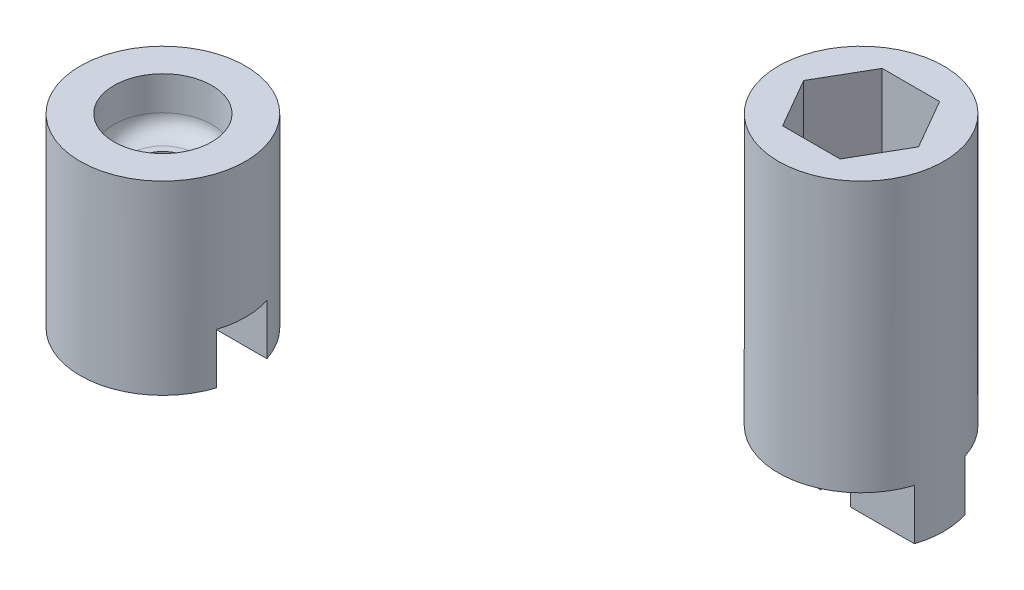
from build123d import *
from build123d.topology import SkipClean

# Parameters (mm, degrees)
EXTRUDE_1_DEPTH          = 3
SKETCH_2_R               = 5.35
EXTRUDE_2_DEPTH          = 23
CUT_EXTRUDE_1_DEPTH      = 3
SKETCH_4_R               = 5
EXTRUDE_3_DEPTH          = 100
EXTRUDE_START            = 3
SKETCH_5_R               = 5
EXTRUDE_4_DEPTH          = 3
SKETCH_6_R               = 5.35
EXTRUDE_5_DEPTH          = 5
SKETCH_7_R               = 5.35
EXTRUDE_6_DEPTH          = 5
SKETCH_8_W               = 75
SKETCH_8_H               = 10.7
EXTRUDE_7_DEPTH          = 3
EXTRUDE_8_DEPTH          = 3
CUT_EXTRUDE_2_DEPTH      = 3
SKETCH_12_R              = 6
EXTRUDE_10_DEPTH         = 13
SKETCH_13_R              = 3
CUT_EXTRUDE_3_DEPTH      = 23
SKETCH_14_R              = 3.125
CUT_EXTRUDE_5_DEPTH      = 100
SKETCH_15_R              = 6
SKETCH_15_R_2            = 5.35
EXTRUDE_11_DEPTH         = 5
SKETCH_16_R              = 6
SKETCH_16_R_2            = 3
EXTRUDE_12_DEPTH         = 5
SKETCH_17_R              = 5.35
SKETCH_17_R_2            = 3
EXTRUDE_13_DEPTH         = 5
SKETCH_18_R              = 5.35
SKETCH_18_R_2            = 3
EXTRUDE_14_DEPTH         = 5
SKETCH_20_R              = 6
SKETCH_20_R_2            = 5.35
EXTRUDE_15_DEPTH         = 5
SKETCH_21_R              = 6
SKETCH_21_R_2            = 5.35
EXTRUDE_16_DEPTH         = 5
SKETCH_22_R              = 5.35
SKETCH_22_R_2            = 3
EXTRUDE_17_DEPTH         = 5
SKETCH_23_R              = 5.35
SKETCH_23_R_2            = 3
EXTRUDE_18_DEPTH         = 5
SKETCH_25_R              = 7.5
EXTRUDE_20_DEPTH         = 3
EXTRUDE_21_DEPTH         = 3
EXTRUDE_23_DEPTH         = 3
SKETCH_30_R              = 7.5
EXTRUDE_24_DEPTH         = 3
FILLET_1_R               = 3
EXTRUDE_29_DEPTH         = 5
EXTRUDE_31_DEPTH         = 2
SKETCH_50_R              = 5.998205811
EXTRUDE_32_DEPTH         = 103
CUT_EXTRUDE_START        = -95
SKETCH_52_R              = 5.998205811
SKETCH_52_R_2            = 4.9
CUT_EXTRUDE_7_DEPTH      = 95
CUT_EXTRUDE_START_2      = -44
SKETCH_53_R              = 4.9
CUT_EXTRUDE_8_DEPTH      = 44
SKETCH_54_R              = 1.5
EXTRUDE_33_DEPTH         = 5
CUT_EXTRUDE_9_DEPTH      = 56
CUT_EXTRUDE_START_3      = -6
SKETCH_56_R              = 1.5
CUT_EXTRUDE_10_DEPTH     = 6
SKETCH_57_R              = 15
EXTRUDE_34_DEPTH         = 3
SKETCH_58_R              = 4.9
EXTRUDE_35_DEPTH         = 51
CUT_EXTRUDE_11_DEPTH     = 5
SKETCH_60_R              = 2.75
CUT_EXTRUDE_12_DEPTH     = 46
SKETCH_61_R              = 1.5
CUT_EXTRUDE_13_DEPTH     = 9
CUT_EXTRUDE_14_DEPTH     = 1.65
SKETCH_63_R              = 1
CUT_EXTRUDE_15_DEPTH     = 1.5
PATTERN_CIRCULAR_1_COUNT = 8
SKETCH_64_R              = 3.175426481
CUT_EXTRUDE_17_DEPTH     = 5
CUT_EXTRUDE_18_DEPTH     = 56
FILLET_2_R               = 1
EXTRUDE_36_DEPTH         = 5
SKETCH_67_R              = 1.5
CUT_EXTRUDE_19_DEPTH     = 5
FILLET_3_R               = 1
SKETCH_69_R              = 4.9
EXTRUDE_37_DEPTH         = 3
CUT_EXTRUDE_20_DEPTH     = 3
CUT_EXTRUDE_21_DEPTH     = 3
SKETCH_71_R              = 2.9
CUT_EXTRUDE_22_DEPTH     = 46
FILLET_4_R               = 1
SKETCH_72_R              = 1.742227019
CUT_EXTRUDE_23_DEPTH     = 3
SKETCH_73_R              = 80.568132645
CUT_EXTRUDE_24_DEPTH     = 40
SKETCH_74_R              = 81.791796687
CUT_EXTRUDE_25_DEPTH     = 40


with BuildPart() as part:
    # 草图1 → 凸台-拉伸1 (new body)
    with BuildSketch(Plane(origin=(0, 0, 0), x_dir=(1, 0, 0), z_dir=(0, 1, 0))):
        Polygon((-18.65535641, 0), (18.84464359, -42.930983399), (56.34464359, 0), align=None)
    extrude(amount=EXTRUDE_1_DEPTH)

    # 草图2 → 凸台-拉伸2 (add)
    with BuildSketch(Plane(origin=(0, 3, 0), x_dir=(1, 0, 0), z_dir=(0, 1, 0))):
        with Locations(Location((56.34464359, 0, 0), (0, 0, 270))):
            Circle(SKETCH_2_R)
        with Locations(Location((-18.65535641, 0, 0), (0, 0, 270))):
            Circle(SKETCH_2_R)
    extrude(amount=-EXTRUDE_2_DEPTH)

    # 草图3 → 切除-拉伸1 (cut)
    with BuildSketch(Plane.XZ):
        Polygon((8.632668758, 17.559374543), (1.15609776, 9), (33.75905687, 9), (36.53318942, 9), (29.056618422, 17.559374543), (18.84464359, 29.25031113), align=None)
    extrude(amount=-CUT_EXTRUDE_1_DEPTH, mode=Mode.SUBTRACT)

    # 草图4 → 凸台-拉伸3 (add)
    with BuildSketch(Plane.XZ):
        with Locations(Location((18.84464359, 42.930983399, 0), (0, 0, 228.862949093))):
            Circle(SKETCH_4_R)
    extrude(amount=EXTRUDE_3_DEPTH)

    # 草图5 → 凸台-拉伸4 (add)
    with BuildSketch(Plane(origin=(0, 0, 0), x_dir=(1, 0, 0), z_dir=(0, 1, 0)).offset(EXTRUDE_START)):
        with Locations(Location((18.84464359, -42.930983399, 0), (0, 0, 131.137050907))):
            Circle(SKETCH_5_R)
    extrude(amount=-EXTRUDE_4_DEPTH)

    # 草图6 → 凸台-拉伸5 (add)
    with SkipClean():  # the faces are left unmerged after this step: merging them gives an invalid solid
        with BuildSketch(Plane.XZ.offset(20)):
            with Locations(Location((56.34464359, 0, 0), (0, 0, 131.137050907))):
                Circle(SKETCH_6_R)
        extrude(amount=EXTRUDE_5_DEPTH)
    add(part.part.scale(1), mode=Mode.REPLACE)  # the faces are merged on a copy

    # 草图7 → 凸台-拉伸6 (add)
    with BuildSketch(Plane.XZ.offset(20)):
        with Locations(Location((-18.65535641, 0, 0), (0, 0, 48.862949093))):
            Circle(SKETCH_7_R)
    extrude(amount=EXTRUDE_6_DEPTH)

    # 草图8 → 凸台-拉伸7 (add)
    with SkipClean():  # the faces are left unmerged after this step: merging them gives an invalid solid
        with BuildSketch(Plane(origin=(0, 3, 0), x_dir=(1, 0, 0), z_dir=(0, 1, 0))):
            with Locations((18.84464359, 0)):
                Rectangle(SKETCH_8_W, SKETCH_8_H)
        extrude(amount=-EXTRUDE_7_DEPTH)

    # 草图9 → 凸台-拉伸8 (add)
    with SkipClean():  # the faces are left unmerged after this step: merging them gives an invalid solid
        with BuildSketch(Plane(origin=(0, 3, 0), x_dir=(1, 0, 0), z_dir=(0, 1, 0))):
            Polygon((61.69464359, 0), (18.84464359, -47.930983399), (-24.00535641, 0), align=None)
        extrude(amount=-EXTRUDE_8_DEPTH)

    # 草图10 → 切除-拉伸2 (cut)
    with SkipClean():  # the faces are left unmerged after this step: merging them gives an invalid solid
        with BuildSketch(Plane.XZ):
            Polygon((18.84464359, 37.930983399), (-13.313716495, 0.298969924), (50.99464359, 0), align=None)
        extrude(amount=-CUT_EXTRUDE_2_DEPTH, mode=Mode.SUBTRACT)

    # 草图12 → 凸台-拉伸10 (add)
    with SkipClean():  # the faces are left unmerged after this step: merging them gives an invalid solid
        with BuildSketch(Plane(origin=(0, 3, 0), x_dir=(1, 0, 0), z_dir=(0, 1, 0))):
            with Locations(Location((-18.65535641, 0, 0), (0, 0, 270))):
                Circle(SKETCH_12_R)
            with Locations(Location((56.34464359, 0, 0), (0, 0, 270))):
                Circle(SKETCH_12_R)
        extrude(amount=-EXTRUDE_10_DEPTH)

    # 草图13 → 切除-拉伸3 (cut)
    with SkipClean():  # the faces are left unmerged after this step: merging them gives an invalid solid
        with BuildSketch(Plane.XZ.offset(25)):
            with Locations(Location((-18.65535641, 0, 0), (0, 0, 270))):
                Circle(SKETCH_13_R)
            with Locations(Location((56.34464359, 0, 0), (0, 0, 270))):
                Circle(SKETCH_13_R)
        extrude(amount=-CUT_EXTRUDE_3_DEPTH, mode=Mode.SUBTRACT)

    # 草图14 → 切除-拉伸5 (cut)
    with SkipClean():  # the faces are left unmerged after this step: merging them gives an invalid solid
        with BuildSketch(Plane.XZ.offset(100)):
            with Locations(Location((18.84464359, 42.930983399, 0), (0, 0, 270))):
                Circle(SKETCH_14_R)
        extrude(amount=-CUT_EXTRUDE_5_DEPTH, mode=Mode.SUBTRACT)

    # 草图15 → 凸台-拉伸11 (add)
    with SkipClean():  # the faces are left unmerged after this step: merging them gives an invalid solid
        with BuildSketch(Plane.XZ.offset(10)):
            with Locations(Location((56.34464359, 0, 0), (0, 0, 90.133194259))):
                Circle(SKETCH_15_R)
            with Locations(Location((56.34464359, 0, 0), (0, 0, 270))):
                Circle(SKETCH_15_R_2, mode=Mode.SUBTRACT)
        extrude(amount=EXTRUDE_11_DEPTH)

    # 草图16 → 凸台-拉伸12 (add)
    with SkipClean():  # the faces are left unmerged after this step: merging them gives an invalid solid
        with BuildSketch(Plane.XZ.offset(10)):
            with Locations(Location((-18.65535641, 0, 0), (0, 0, 89.866805741))):
                Circle(SKETCH_16_R)
            with Locations(Location((-18.65535641, 0, 0), (0, 0, 270))):
                Circle(SKETCH_16_R_2, mode=Mode.SUBTRACT)
        extrude(amount=EXTRUDE_12_DEPTH)

    # 草图17 → 凸台-拉伸13 (add)
    with SkipClean():  # the faces are left unmerged after this step: merging them gives an invalid solid
        with BuildSketch(Plane.XZ.offset(25)):
            with Locations(Location((-18.65535641, 0, 0), (0, 0, 270))):
                Circle(SKETCH_17_R)
            with Locations(Location((-18.65535641, 0, 0), (0, 0, 270))):
                Circle(SKETCH_17_R_2, mode=Mode.SUBTRACT)
        extrude(amount=EXTRUDE_13_DEPTH)

    # 草图18 → 凸台-拉伸14 (add)
    with SkipClean():  # the faces are left unmerged after this step: merging them gives an invalid solid
        with BuildSketch(Plane.XZ.offset(25)):
            with Locations(Location((56.34464359, 0, 0), (0, 0, 270))):
                Circle(SKETCH_18_R)
            with Locations(Location((56.34464359, 0, 0), (0, 0, 270))):
                Circle(SKETCH_18_R_2, mode=Mode.SUBTRACT)
        extrude(amount=EXTRUDE_14_DEPTH)

    # 草图20 → 凸台-拉伸15 (add)
    with SkipClean():  # the faces are left unmerged after this step: merging them gives an invalid solid
        with BuildSketch(Plane.XZ.offset(15)):
            with Locations(Location((-18.65535641, 0, 0), (0, 0, 89.866805741))):
                Circle(SKETCH_20_R)
            with Locations(Location((-18.65535641, 0, 0), (0, 0, 270))):
                Circle(SKETCH_20_R_2, mode=Mode.SUBTRACT)
        extrude(amount=EXTRUDE_15_DEPTH)

    # 草图21 → 凸台-拉伸16 (add)
    with SkipClean():  # the faces are left unmerged after this step: merging them gives an invalid solid
        with BuildSketch(Plane.XZ.offset(15)):
            with Locations(Location((56.34464359, 0, 0), (0, 0, 90.133194259))):
                Circle(SKETCH_21_R)
            with Locations(Location((56.34464359, 0, 0), (0, 0, 270))):
                Circle(SKETCH_21_R_2, mode=Mode.SUBTRACT)
        extrude(amount=EXTRUDE_16_DEPTH)

    # 草图22 → 凸台-拉伸17 (add)
    with SkipClean():  # the faces are left unmerged after this step: merging them gives an invalid solid
        with BuildSketch(Plane.XZ.offset(30)):
            with Locations(Location((-18.65535641, 0, 0), (0, 0, 270))):
                Circle(SKETCH_22_R)
            with Locations(Location((-18.65535641, 0, 0), (0, 0, 270))):
                Circle(SKETCH_22_R_2, mode=Mode.SUBTRACT)
        extrude(amount=EXTRUDE_17_DEPTH)

    # 草图23 → 凸台-拉伸18 (add)
    with SkipClean():  # the faces are left unmerged after this step: merging them gives an invalid solid
        with BuildSketch(Plane.XZ.offset(30)):
            with Locations(Location((56.34464359, 0, 0), (0, 0, 270))):
                Circle(SKETCH_23_R)
            with Locations(Location((56.34464359, 0, 0), (0, 0, 270))):
                Circle(SKETCH_23_R_2, mode=Mode.SUBTRACT)
        extrude(amount=EXTRUDE_18_DEPTH)

    # 草图25 → 凸台-拉伸20 (add)
    with SkipClean():  # the faces are left unmerged after this step: merging them gives an invalid solid
        with BuildSketch(Plane(origin=(0, 3, 0), x_dir=(1, 0, 0), z_dir=(0, 1, 0))):
            with Locations((18.84464359, -42.930983399)):
                Circle(SKETCH_25_R)
        extrude(amount=-EXTRUDE_20_DEPTH)

    # 草图28 → 凸台-拉伸21 (add)
    with SkipClean():  # the faces are left unmerged after this step: merging them gives an invalid solid
        with BuildSketch(Plane(origin=(0, 3, 0), x_dir=(1, 0, 0), z_dir=(0, 1, 0))):
            Polygon((-3.379636645, -23.071435978), (2.093554995, -18.328702995), (68.652557408, -96.216669577), (66.868599364, -97.910067347), (64.321605904, -100.026810209), align=None)
        extrude(amount=-EXTRUDE_21_DEPTH)

    # 草图29 → 凸台-拉伸23 (add)
    with SkipClean():  # the faces are left unmerged after this step: merging them gives an invalid solid
        with BuildSketch(Plane(origin=(0, 3, 0), x_dir=(1, 0, 0), z_dir=(0, 1, 0))):
            Polygon((56.34464359, 0), (53.74105837, -88), (59.74105837, -88), (62.34464359, 0), align=None)
        extrude(amount=-EXTRUDE_23_DEPTH)

    # 草图30 → 凸台-拉伸24 (add)
    with SkipClean():  # the faces are left unmerged after this step: merging them gives an invalid solid
        with BuildSketch(Plane(origin=(0, 3, 0), x_dir=(1, 0, 0), z_dir=(0, 1, 0))):
            with Locations((62.6531538, -93.694621783)):
                Circle(SKETCH_30_R)
        extrude(amount=-EXTRUDE_24_DEPTH)

    # 圆角1
    # the kernel refuses this fillet: 3 mm, written as the material it adds along each edge
    with BuildSketch(Plane(origin=(60.387632696, 0, 86.544977448), x_dir=(-0.6496534253779116, 0, -0.760230509052844), z_dir=(0, 1, 0))) as fillet_1_piece_1:
        with BuildLine():
            CenterArc((1.763131122, -3), FILLET_1_R, 90, 55.663998218)
            ThreePointArc((-0.714100998, -1.307864951), (-0.324488751, -0.671711358), (0, 0))
            Line((0, 0), (1.763131122, 0))
        make_face()
    extrude(amount=3)
    with BuildSketch(Plane(origin=(59.804303017, 0, 85.862359607), x_dir=(0.02957325513951661, 0, -0.9995626156376863), z_dir=(0, 1, 0))) as fillet_1_piece_2:
        with BuildLine():
            CenterArc((FILLET_1_R * 0.38596961824, -FILLET_1_R), FILLET_1_R, 90, 42.210146514)
            Line((-FILLET_1_R * 0.285882149698, -FILLET_1_R * 0.259314370385), (0, 0))
            Line((0, 0), (FILLET_1_R * 0.38596961824, 0))
        make_face()
    extrude(amount=3)

    # 草图31 → 凸台-拉伸29 (add)
    with BuildSketch(Plane.XZ):
        Polygon((-14.723586471, -1.628179316), (-14.723586471, -3.628179316), (53.527409972, -3.628179316), (53.82491501, -1.628179316), align=None)
        Polygon((49.609847968, 80.102545011), (51.130308987, 78.80323816), (22.318773999, 45.087710689), (20.798312981, 46.38701754), align=None)
        Polygon((-15.349607435, 4.086383285), (-13.829146417, 2.787076434), (17.097273349, 38.977461836), (15.576812331, 40.276768687), align=None)
        Polygon((20.325894576, 39.186783249), (51.86894969, 1.971881231), (53.394639731, 3.265043982), (21.851584617, 40.479945999), align=None)
        Polygon((56.093860655, 78.864293565), (58.318881117, 3.659610745), (60.319756269, 3.659610745), (58.092985887, 78.923440075), align=None)
    extrude(amount=EXTRUDE_29_DEPTH)

    # 切除-扫描1: sweep along a path in 草图36
    with BuildLine(Plane.XZ.offset(5)) as sweep_1_path:
        Line((18.84464359, -3.628179316), (18.84464359, -1.628179316))
    # 草图35 → 切除-扫描1 (sweep, cut)
    with BuildSketch(Plane(origin=(0, 0, -3.628179316), x_dir=(-1, 0, 0), z_dir=(0, 0, -1))):
        Polygon((13.876620714, -5), (9.876620714, -2), (-47.565907894, -2), (-51.565907894, -5), align=None)
    sweep(path=sweep_1_path.line, mode=Mode.SUBTRACT)

    # 切除-扫描3: sweep along a path in 草图38
    with BuildLine(Plane.XZ.offset(5)) as sweep_3_path:
        Line((59.19369399, 41.720005215), (57.192818839, 41.720005215))
    # 草图37 → 切除-扫描3 (sweep, cut)
    with BuildSketch(Plane(origin=(60.375181238, 0, 1.786271926), x_dir=(0.029573255139513054, 0, -0.9995626156376864), z_dir=(0.9995626156376866, 0, 0.029573255139513057))):
        Polygon((-2.73149314, -5), (-6.73149314, -1), (-73.170921503, -1), (-77.170921503, -5), align=None)
    sweep(path=sweep_3_path.line, mode=Mode.SUBTRACT)

    # 草图39 → 凸台-拉伸31 (add)
    with BuildSketch(Plane(origin=(58.376056006, 0, 1.727125416), x_dir=(0.02957325513951297, 0, -0.9995626156376864), z_dir=(0.9995626156376866, 0, 0.029573255139512974))):
        Polygon((-3.961044, -3.829621531), (-3.961044, -5), (-2.73149314, -5), (-2.73149314, -4.501704435), (-3.961044, -3.272153575), align=None)
    extrude(amount=EXTRUDE_31_DEPTH)

    # 切除-扫描5: sweep along a path in 草图42
    with BuildLine(Plane.XZ.offset(5)) as sweep_5_path:
        Line((0.095091388, 22.159914171), (1.552120507, 20.786378718))
    # 草图40 → 切除-扫描5 (sweep, cut)
    with BuildSketch(Plane(origin=(-10.889521113, 0, 9.305617977), x_dir=(0.6496534253779145, 0, 0.7602305090528415), z_dir=(-0.7602305090528415, 0, 0.6496534253779145))):
        Polygon((-5.121187346, -5), (-3.121187346, -1), (36.9380259, -1), (38.9380259, -5), align=None)
    sweep(path=sweep_5_path.line, mode=Mode.SUBTRACT)

    # 切除-扫描6: sweep along a path in 草图44
    with BuildLine(Plane.XZ.offset(5)) as sweep_6_path:
        Line((36.035656698, 20.652203895), (37.472857905, 22.049766909))
    # 草图43 → 切除-扫描6 (sweep, cut)
    with BuildSketch(Plane(origin=(31.1568423, 0, 26.408291855), x_dir=(-0.6465813751887421, 0, 0.7628450204720715), z_dir=(-0.7628450204720715, 0, -0.6465813751887421))):
        Polygon((14.734624595, -5), (12.734624595, -1), (-27.825731715, -1), (-29.825731715, -5), align=None)
    sweep(path=sweep_6_path.line, mode=Mode.SUBTRACT)

    # 切除-扫描7: sweep along a path in 草图47
    with BuildLine(Plane.XZ.offset(5)) as sweep_7_path:
        Line((37.03221924, 62.305521799), (35.511758222, 63.60482865))
    # 草图46 → 切除-扫描7 (sweep, cut)
    with BuildSketch(Plane(origin=(-10.889521113, 0, 9.305617977), x_dir=(0.6496534253779142, 0, 0.7602305090528417), z_dir=(-0.7602305090528417, 0, 0.6496534253779142))):
        Polygon((50.821835343, -5), (52.821835343, -1), (88.125606235, -1), (93.125606235, 0), (93.125606235, -5), align=None)
    sweep(path=sweep_7_path.line, mode=Mode.SUBTRACT)

    # 切除-扫描8: sweep along a path in 草图49
    with BuildLine(Plane.XZ.offset(1)) as sweep_8_path:
        Line((58.211278907, 74.925189613), (56.210403756, 74.925189613))
        Line((56.210403756, 74.925189613), (55.379994456, 74.925189613))
    # 草图48 → 切除-扫描8 (sweep, cut)
    with BuildSketch(Plane(origin=(60.375181238, 0, 1.786271926), x_dir=(0.029573255139513054, 0, -0.9995626156376864), z_dir=(0.9995626156376866, 0, 0.029573255139513057))):
        Polygon((-73.170921503, -1), (-77.170921503, 0), (-77.170921503, -5), align=None)
    sweep(path=sweep_8_path.line, mode=Mode.SUBTRACT)

    # 草图50 → 凸台-拉伸32 (add)
    with BuildSketch(Plane(origin=(0, 3, 0), x_dir=(1, 0, 0), z_dir=(0, 1, 0))):
        with Locations(Location((18.84464359, -42.930983399, 0), (0, 0, 270))):
            Circle(SKETCH_50_R)
    extrude(amount=-EXTRUDE_32_DEPTH)

    # 草图52 → 切除-拉伸7 (cut)
    with BuildSketch(Plane.XZ.offset(100).offset(CUT_EXTRUDE_START)):
        with Locations((18.84464359, 42.930983399)):
            Circle(SKETCH_52_R)
        with Locations(Location((18.84464359, 42.930983399, 0), (0, 0, 270))):
            Circle(SKETCH_52_R_2, mode=Mode.SUBTRACT)
    extrude(amount=CUT_EXTRUDE_7_DEPTH, mode=Mode.SUBTRACT)

    # 草图53 → 切除-拉伸8 (cut)
    with BuildSketch(Plane.XZ.offset(100).offset(CUT_EXTRUDE_START_2)):
        with Locations(Location((18.84464359, 42.930983399, 0), (0, 0, 270))):
            Circle(SKETCH_53_R)
    extrude(amount=CUT_EXTRUDE_8_DEPTH, mode=Mode.SUBTRACT)

    # 草图54 → 凸台-拉伸33 (add)
    with BuildSketch(Plane.XZ.offset(56)):
        Polygon((22.020070071, 42.930983399), (20.43235683, 45.680983399), (17.25693035, 45.680983399), (15.669217109, 42.930983399), (17.25693035, 40.180983399), (20.43235683, 40.180983399), align=None)
        with Locations(Location((18.84464359, 42.930983399, 0), (0, 0, 270))):
            Circle(SKETCH_54_R, mode=Mode.SUBTRACT)
    extrude(amount=EXTRUDE_33_DEPTH)

    # 草图55 → 切除-拉伸9 (cut)
    with BuildSketch(Plane(origin=(0, 3, 0), x_dir=(1, 0, 0), z_dir=(0, 1, 0))):
        Polygon((22.077805097, -42.930983399), (20.461224344, -40.130983399), (17.228062836, -40.130983399), (15.611482083, -42.930983399), (17.228062836, -45.730983399), (20.461224344, -45.730983399), align=None)
    extrude(amount=-CUT_EXTRUDE_9_DEPTH, mode=Mode.SUBTRACT)

    # 草图56 → 切除-拉伸10 (cut)
    with BuildSketch(Plane.XZ.offset(56).offset(CUT_EXTRUDE_START_3)):
        with Locations(Location((18.84464359, 42.930983399, 0), (0, 0, 90))):
            Circle(SKETCH_56_R)
    extrude(amount=CUT_EXTRUDE_10_DEPTH, mode=Mode.SUBTRACT)

    # 草图64 → 切除-拉伸17 (cut)
    with BuildSketch(Plane.XZ.offset(61)):
        with Locations((18.84464359, 42.930983399)):
            Circle(SKETCH_64_R)
    extrude(amount=-CUT_EXTRUDE_17_DEPTH, mode=Mode.SUBTRACT)

    # 草图65 → 切除-拉伸18 (cut)
    with BuildSketch(Plane(origin=(0, 3, 0), x_dir=(1, 0, 0), z_dir=(0, 1, 0))):
        Polygon((22.251010178, -42.930983399), (20.547826884, -39.980983399), (17.141460296, -39.980983399), (15.438277002, -42.930983399), (17.141460296, -45.880983399), (20.547826884, -45.880983399), align=None)
    extrude(amount=-CUT_EXTRUDE_18_DEPTH, mode=Mode.SUBTRACT)

    # 圆角2
    # the kernel refuses this fillet: 1 mm, written as the material it adds along each edge
    with BuildSketch(Plane(origin=(19.297826884, -53, 48.046046908), x_dir=(0, 1, 0), z_dir=(0.49999999999999994, 0, -0.8660254037844387))) as fillet_2_piece_1_section:
        with BuildLine():
            CenterArc((FILLET_2_R, -FILLET_2_R), FILLET_2_R, 90, 90)
            Line((0, -FILLET_2_R), (0, 0))
            Line((0, 0), (FILLET_2_R, 0))
        make_face()
    fillet_2_piece_1 = extrude(amount=8.406366588, mode=Mode.PRIVATE)
    fillet_2_piece_1 = split(fillet_2_piece_1, bisect_by=Plane(origin=(21.196381273, -52.783149841, 45.880983399), z_dir=(0, 0, -1)), keep=Keep.TOP, mode=Mode.PRIVATE)
    fillet_2_piece_1 = split(fillet_2_piece_1, bisect_by=Plane(origin=(22.575287373, -52.783149841, 43.492647975), z_dir=(-0.8660254037844382, 0, 0.5000000000000009)), keep=Keep.TOP, mode=Mode.PRIVATE)
    add(fillet_2_piece_1)
    with BuildSketch(Plane(origin=(14.641460296, -53, 45.880983399), x_dir=(0, 1, 0), z_dir=(1, 0, 0))) as fillet_2_piece_2_section:
        with BuildLine():
            CenterArc((FILLET_2_R, -FILLET_2_R), FILLET_2_R, 90, 90)
            Line((0, -FILLET_2_R), (0, 0))
            Line((0, 0), (FILLET_2_R, 0))
        make_face()
    fillet_2_piece_2 = extrude(amount=8.406366588, mode=Mode.PRIVATE)
    fillet_2_piece_2 = split(fillet_2_piece_2, bisect_by=Plane(origin=(20.22354969, -52.783149841, 46.442647975), z_dir=(-0.8660254037844387, 0, -0.49999999999999994)), keep=Keep.TOP, mode=Mode.PRIVATE)
    fillet_2_piece_2 = split(fillet_2_piece_2, bisect_by=Plane(origin=(17.46573749, -52.783149841, 46.442647975), z_dir=(0.8660254037844393, 0, -0.49999999999999906)), keep=Keep.TOP, mode=Mode.PRIVATE)
    add(fillet_2_piece_2)
    with BuildSketch(Plane(origin=(14.188277002, -53, 40.765919889), x_dir=(0, 1, 0), z_dir=(0.49999999999999906, 0, 0.8660254037844393))) as fillet_2_piece_3_section:
        with BuildLine():
            CenterArc((FILLET_2_R, -FILLET_2_R), FILLET_2_R, 90, 90)
            Line((0, -FILLET_2_R), (0, 0))
            Line((0, 0), (FILLET_2_R, 0))
        make_face()
    fillet_2_piece_3 = extrude(amount=8.406366588, mode=Mode.PRIVATE)
    fillet_2_piece_3 = split(fillet_2_piece_3, bisect_by=Plane(origin=(16.492905907, -52.783149841, 45.880983399), z_dir=(0, 0, -1)), keep=Keep.TOP, mode=Mode.PRIVATE)
    fillet_2_piece_3 = split(fillet_2_piece_3, bisect_by=Plane(origin=(15.113999807, -52.783149841, 43.492647975), z_dir=(0.8660254037844386, 0, 0.5000000000000002)), keep=Keep.TOP, mode=Mode.PRIVATE)
    add(fillet_2_piece_3)
    with BuildSketch(Plane(origin=(18.391460296, -53, 37.815919889), x_dir=(0, 1, 0), z_dir=(-0.5000000000000002, 0, 0.8660254037844386))) as fillet_2_piece_4_section:
        with BuildLine():
            CenterArc((FILLET_2_R, -FILLET_2_R), FILLET_2_R, 90, 90)
            Line((0, -FILLET_2_R), (0, 0))
            Line((0, 0), (FILLET_2_R, 0))
        make_face()
    fillet_2_piece_4 = extrude(amount=8.406366588, mode=Mode.PRIVATE)
    fillet_2_piece_4 = split(fillet_2_piece_4, bisect_by=Plane(origin=(15.113999807, -52.783149841, 42.369318822), z_dir=(0.8660254037844393, 0, -0.49999999999999906)), keep=Keep.TOP, mode=Mode.PRIVATE)
    fillet_2_piece_4 = split(fillet_2_piece_4, bisect_by=Plane(origin=(16.492905907, -52.783149841, 39.980983399), z_dir=(0, 0, 1)), keep=Keep.TOP, mode=Mode.PRIVATE)
    add(fillet_2_piece_4)
    with BuildSketch(Plane(origin=(23.047826884, -53, 39.980983399), x_dir=(0, 1, 0), z_dir=(-1, 0, 0))) as fillet_2_piece_5_section:
        with BuildLine():
            CenterArc((FILLET_2_R, -FILLET_2_R), FILLET_2_R, 90, 90)
            Line((0, -FILLET_2_R), (0, 0))
            Line((0, 0), (FILLET_2_R, 0))
        make_face()
    fillet_2_piece_5 = extrude(amount=8.406366588, mode=Mode.PRIVATE)
    fillet_2_piece_5 = split(fillet_2_piece_5, bisect_by=Plane(origin=(17.46573749, -52.783149841, 39.419318822), z_dir=(0.8660254037844386, 0, 0.5000000000000002)), keep=Keep.TOP, mode=Mode.PRIVATE)
    fillet_2_piece_5 = split(fillet_2_piece_5, bisect_by=Plane(origin=(20.22354969, -52.783149841, 39.419318822), z_dir=(-0.8660254037844382, 0, 0.5000000000000009)), keep=Keep.TOP, mode=Mode.PRIVATE)
    add(fillet_2_piece_5)
    with BuildSketch(Plane(origin=(23.501010178, -53, 45.096046908), x_dir=(0, 1, 0), z_dir=(-0.5000000000000009, 0, -0.8660254037844382))) as fillet_2_piece_6_section:
        with BuildLine():
            CenterArc((FILLET_2_R, -FILLET_2_R), FILLET_2_R, 90, 90)
            Line((0, -FILLET_2_R), (0, 0))
            Line((0, 0), (FILLET_2_R, 0))
        make_face()
    fillet_2_piece_6 = extrude(amount=8.406366588, mode=Mode.PRIVATE)
    fillet_2_piece_6 = split(fillet_2_piece_6, bisect_by=Plane(origin=(22.575287373, -52.783149841, 42.369318822), z_dir=(-0.8660254037844387, 0, -0.49999999999999994)), keep=Keep.TOP, mode=Mode.PRIVATE)
    fillet_2_piece_6 = split(fillet_2_piece_6, bisect_by=Plane(origin=(21.196381273, -52.783149841, 39.980983399), z_dir=(0, 0, 1)), keep=Keep.TOP, mode=Mode.PRIVATE)
    add(fillet_2_piece_6)

    # 草图69 → 凸台-拉伸37 (add)
    with BuildSketch(Plane.XZ.offset(56)):
        with Locations(Location((18.84464359, 42.930983399, 0), (0, 0, 270))):
            Circle(SKETCH_69_R)
    extrude(amount=EXTRUDE_37_DEPTH)

    # 草图68 → 切除-拉伸20 (cut)
    with BuildSketch(Plane.XZ.offset(56)):
        Polygon((17.97353008, 41.422170541), (13.94464359, 41.430983399), (15.863729909, 37.533957775), (21.64727463, 37.627802071), (23.74464359, 41.430983399), (19.7157571, 41.422170541), (20.586870609, 42.930983399), (19.7157571, 44.439796256), (23.74464359, 44.430983399), (21.991739507, 48.037279535), (15.697547673, 48.037279535), (13.94464359, 44.430983399), (17.97353008, 44.439796256), (17.102416571, 42.930983399), align=None)
    extrude(amount=CUT_EXTRUDE_20_DEPTH, mode=Mode.SUBTRACT)

    # 草图72 → 切除-拉伸23 (cut)
    with BuildSketch(Plane.XZ.offset(56)):
        with Locations((18.84464359, 42.930983399)):
            Circle(SKETCH_72_R)
    extrude(amount=CUT_EXTRUDE_23_DEPTH, mode=Mode.SUBTRACT)


with BuildPart() as body_2:
    # 草图57 → 凸台-拉伸34 (new body)
    with BuildSketch(Plane(origin=(0, 0, 0), x_dir=(1, 0, 0), z_dir=(0, 1, 0))):
        with Locations(Location((-1.85085497, -63.626481958, 0), (0, 0, 270))):
            Circle(SKETCH_57_R)
    extrude(amount=EXTRUDE_34_DEPTH)

    # 草图58 → 凸台-拉伸35 (add)
    with BuildSketch(Plane.XZ):
        with Locations(Location((-1.85085497, 63.626481958, 0), (0, 0, 90))):
            Circle(SKETCH_58_R)
    extrude(amount=EXTRUDE_35_DEPTH)

    # 草图59 → 切除-拉伸11 (cut)
    with BuildSketch(Plane.XZ.offset(51)):
        Polygon((1.324571511, 63.626481958), (-0.263141729, 66.376481958), (-3.43856821, 66.376481958), (-5.02628145, 63.626481958), (-3.43856821, 60.876481958), (-0.263141729, 60.876481958), align=None)
    extrude(amount=-CUT_EXTRUDE_11_DEPTH, mode=Mode.SUBTRACT)

    # 草图60 → 切除-拉伸12 (cut)
    with BuildSketch(Plane(origin=(0, 3, 0), x_dir=(1, 0, 0), z_dir=(0, 1, 0))):
        with Locations(Location((-1.85085497, -63.626481958, 0), (0, 0, 270))):
            Circle(SKETCH_60_R)
    extrude(amount=-CUT_EXTRUDE_12_DEPTH, mode=Mode.SUBTRACT)

    # 草图61 → 切除-拉伸13 (cut)
    with BuildSketch(Plane.XZ.offset(46)):
        with Locations(Location((-1.85085497, 63.626481958, 0), (0, 0, 270))):
            Circle(SKETCH_61_R)
    extrude(amount=-CUT_EXTRUDE_13_DEPTH, mode=Mode.SUBTRACT)

    # 草图62 → 切除-拉伸14 (cut)
    with BuildSketch(Plane.XZ):
        Polygon((10.516281134, 63.626481958), (9.332713082, 65.676481958), (6.965576978, 65.676481958), (5.782008927, 63.626481958), (6.965576978, 61.576481958), (9.332713082, 61.576481958), align=None)
    cut_extrude_14 = extrude(amount=-CUT_EXTRUDE_14_DEPTH, mode=Mode.SUBTRACT)

    # 草图63 → 切除-拉伸15 (cut)
    with BuildSketch(Plane.XZ.offset(-1.65)):
        with Locations(Location((8.14914503, 63.626481958, 0), (0, 0, 270))):
            Circle(SKETCH_63_R)
    cut_extrude_15 = extrude(amount=-CUT_EXTRUDE_15_DEPTH, mode=Mode.SUBTRACT)

    # 阵列(圆周)1: 切除-拉伸14, 切除-拉伸15 ×8 about axis
    pattern_circular_1_axis = Axis((-1.85085497, 0, 63.626481958), (0, 1, 0))
    add([cut_extrude_14.rotate(pattern_circular_1_axis, i * 360 / PATTERN_CIRCULAR_1_COUNT) for i in range(1, PATTERN_CIRCULAR_1_COUNT)], mode=Mode.SUBTRACT)
    add([cut_extrude_15.rotate(pattern_circular_1_axis, i * 360 / PATTERN_CIRCULAR_1_COUNT) for i in range(1, PATTERN_CIRCULAR_1_COUNT)], mode=Mode.SUBTRACT)

    # 草图66 → 凸台-拉伸36 (add)
    with BuildSketch(Plane.XZ.offset(51)):
        Polygon((1.324571511, 63.626481958), (-0.263141729, 66.376481958), (-3.43856821, 66.376481958), (-5.02628145, 63.626481958), (-3.43856821, 60.876481958), (-0.263141729, 60.876481958), align=None)
    extrude(amount=-EXTRUDE_36_DEPTH)

    # 草图67 → 切除-拉伸19 (cut)
    with BuildSketch(Plane.XZ.offset(51)):
        with Locations(Location((-1.85085497, 63.626481958, 0), (0, 0, 270))):
            Circle(SKETCH_67_R)
    extrude(amount=-CUT_EXTRUDE_19_DEPTH, mode=Mode.SUBTRACT)

    # 圆角3
    fillet_3_edges = [body_2.edges().sort_by_distance(p)[0] for p in [
        (-1.85085497, -43, 60.876481958),
    ]]
    fillet(fillet_3_edges, radius=FILLET_3_R)

    # 草图70 → 切除-拉伸21 (cut)
    with BuildSketch(Plane.XZ.offset(51)):
        Polygon((-2.716880374, 65.126481958), (-0.984829566, 65.126481958), (3.220078331, 65.126481958), (3.220078331, 62.126481958), (-0.984829566, 62.126481958), (-2.716880374, 62.126481958), (-7.47972899, 62.126481958), (-7.47972899, 65.126481958), align=None)
    extrude(amount=-CUT_EXTRUDE_21_DEPTH, mode=Mode.SUBTRACT)

    # 草图71 → 切除-拉伸22 (cut)
    with BuildSketch(Plane(origin=(0, 3, 0), x_dir=(1, 0, 0), z_dir=(0, 1, 0))):
        with Locations(Location((-1.85085497, -63.626481958, 0), (0, 0, 270))):
            Circle(SKETCH_71_R)
    extrude(amount=-CUT_EXTRUDE_22_DEPTH, mode=Mode.SUBTRACT)

    # 圆角4
    fillet_4_edges = [body_2.edges().sort_by_distance(p)[0] for p in [
        (-1.85085497, -43, 60.726481958),
    ]]
    fillet(fillet_4_edges, radius=FILLET_4_R)


with BuildPart() as cut_extrude_24_tool:
    # 草图73 → 切除-拉伸24 (new body)
    with BuildSketch(Plane(origin=(0, 0, 0), x_dir=(1, 0, 0), z_dir=(0, 1, 0))):
        with Locations((18.84464359, -42.930983399)):
            Circle(SKETCH_73_R)
    extrude(amount=-CUT_EXTRUDE_24_DEPTH)


with BuildPart() as part_1:
    add(part.part)

    # 切除-拉伸24: cut by cut_extrude_24_tool
    add(cut_extrude_24_tool.part, mode=Mode.SUBTRACT)


with BuildPart() as body_2_1:
    add(body_2.part)

    # 切除-拉伸24: cut by cut_extrude_24_tool
    add(cut_extrude_24_tool.part, mode=Mode.SUBTRACT)


with BuildPart() as cut_extrude_24_piece_1:
    # of the separate pieces the step leaves, piece 1, a body of its own (cut_extrude_24_pieces)
    add(part_1.part.solids().sort_by_distance((22.251010178, 3, 42.930983399))[0])


with BuildPart() as cut_extrude_24_piece_2:
    # of the separate pieces the step leaves, piece 2, a body of its own (cut_extrude_24_pieces)
    add(part_1.part.solids().sort_by_distance((21.09630964, -53, 42.930983399))[0])


with BuildPart() as cut_extrude_24_piece_1_of_body_2:
    # of the separate pieces the step leaves, piece 1, a body of its own (cut_extrude_24_pieces_of_body_2)
    add(body_2_1.part.solids().sort_by_distance((-1.85085497, 3, 66.526481958))[0])


with BuildPart() as cut_extrude_24_piece_2_of_body_2:
    # of the separate pieces the step leaves, piece 2, a body of its own (cut_extrude_24_pieces_of_body_2)
    add(body_2_1.part.solids().sort_by_distance((-1.85085497, -43, 65.526481958))[0])


with BuildPart() as cut_extrude_25_tool:
    # 草图74 → 切除-拉伸25 (new body)
    with BuildSketch(Plane(origin=(0, 0, 0), x_dir=(1, 0, 0), z_dir=(0, 1, 0))):
        with Locations((18.84464359, -42.930983399)):
            Circle(SKETCH_74_R)
    extrude(amount=CUT_EXTRUDE_25_DEPTH)


with BuildPart() as cut_extrude_24_piece_1_1:
    add(cut_extrude_24_piece_1.part)

    # 切除-拉伸25: cut by cut_extrude_25_tool
    add(cut_extrude_25_tool.part, mode=Mode.SUBTRACT)


with BuildPart() as cut_extrude_24_piece_1_of_body_2_1:
    add(cut_extrude_24_piece_1_of_body_2.part)

    # 切除-拉伸25: cut by cut_extrude_25_tool
    add(cut_extrude_25_tool.part, mode=Mode.SUBTRACT)


solid = Compound([cut_extrude_24_piece_2.part, cut_extrude_24_piece_2_of_body_2.part])
